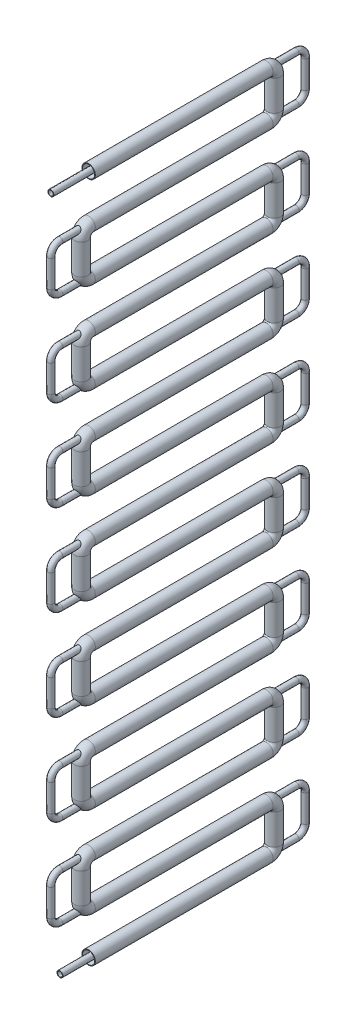
from build123d import *

# Parameters (mm, degrees)
SECCION_AGUA_R           = 8.8
SECCION_AGUA_R_2         = 8
SECCION_REFRIGERANTE_R   = 3.975
SECCION_REFRIGERANTE_R_2 = 3.175


with BuildPart() as part:
    # Tuberia agua: sweep along a path in Recorrido agua
    with BuildLine(Plane(origin=(0, 0, 0), x_dir=(0, 0, -1), z_dir=(1, 0, 0))) as tuberia_agua_path:
        Line((0, 0), (235, 0))
        ThreePointArc((235, 0), (242.071067812, -2.928932188), (245, -10))
        Line((245, -10), (245, -50))
        ThreePointArc((245, -50), (242.071067812, -57.071067812), (235, -60))
        Line((235, -60), (0, -60))
        ThreePointArc((0, -60), (-7.071067812, -62.928932188), (-10, -70))
        Line((-10, -70), (-10, -110))
        ThreePointArc((-10, -110), (-7.071067812, -117.071067812), (0, -120))
        Line((0, -120), (235, -120))
        ThreePointArc((235, -120), (242.071067812, -122.928932188), (245, -130))
        Line((245, -130), (245, -170))
        ThreePointArc((245, -170), (242.071067812, -177.071067812), (235, -180))
        Line((235, -180), (0, -180))
        ThreePointArc((0, -180), (-7.071067812, -182.928932188), (-10, -190))
        Line((-10, -190), (-10, -230))
        ThreePointArc((-10, -230), (-7.071067812, -237.071067812), (0, -240))
        Line((0, -240), (235, -240))
        ThreePointArc((235, -240), (242.071067812, -242.928932188), (245, -250))
        Line((245, -250), (245, -290))
        ThreePointArc((245, -290), (242.071067812, -297.071067812), (235, -300))
        Line((235, -300), (0, -300))
        ThreePointArc((0, -300), (-7.071067812, -302.928932188), (-10, -310))
        Line((-10, -310), (-10, -350))
        ThreePointArc((-10, -350), (-7.071067812, -357.071067812), (0, -360))
        Line((0, -360), (235, -360))
        ThreePointArc((235, -360), (242.071067812, -362.928932188), (245, -370))
        Line((245, -370), (245, -410))
        ThreePointArc((245, -410), (242.071067812, -417.071067812), (235, -420))
        Line((235, -420), (0, -420))
        ThreePointArc((0, -420), (-7.071067812, -422.928932188), (-10, -430))
        Line((-10, -430), (-10, -470))
        ThreePointArc((-10, -470), (-7.071067812, -477.071067812), (0, -480))
        Line((0, -480), (235, -480))
        ThreePointArc((235, -480), (242.071067812, -482.928932188), (245, -490))
        Line((245, -490), (245, -530))
        ThreePointArc((245, -530), (242.071067812, -537.071067812), (235, -540))
        Line((235, -540), (0, -540))
        ThreePointArc((0, -540), (-7.071067812, -542.928932188), (-10, -550))
        Line((-10, -550), (-10, -590))
        ThreePointArc((-10, -590), (-7.071067812, -597.071067812), (0, -600))
        Line((0, -600), (235, -600))
        ThreePointArc((235, -600), (242.071067812, -602.928932188), (245, -610))
        Line((245, -610), (245, -650))
        ThreePointArc((245, -650), (242.071067812, -657.071067812), (235, -660))
        Line((235, -660), (0, -660))
        ThreePointArc((0, -660), (-7.071067812, -662.928932188), (-10, -670))
        Line((-10, -670), (-10, -710))
        ThreePointArc((-10, -710), (-7.071067812, -717.071067812), (0, -720))
        Line((0, -720), (235, -720))
        ThreePointArc((235, -720), (242.071067812, -722.928932188), (245, -730))
        Line((245, -730), (245, -770))
        ThreePointArc((245, -770), (242.071067812, -777.071067812), (235, -780))
        Line((235, -780), (0, -780))
        ThreePointArc((0, -780), (-7.071067812, -782.928932188), (-10, -790))
        Line((-10, -790), (-10, -830))
        ThreePointArc((-10, -830), (-7.071067812, -837.071067812), (0, -840))
        Line((0, -840), (235, -840))
        ThreePointArc((235, -840), (242.071067812, -842.928932188), (245, -850))
        Line((245, -850), (245, -890))
        ThreePointArc((245, -890), (242.071067812, -897.071067812), (235, -900))
        Line((235, -900), (0, -900))
    # Seccion agua → Tuberia agua (sweep)
    with BuildSketch(Plane.XY):
        Circle(SECCION_AGUA_R)
        Circle(SECCION_AGUA_R_2, mode=Mode.SUBTRACT)
    sweep(path=tuberia_agua_path.line)

    # Tuberia refrigerante: sweep along a path in Recorrido refrigerante
    with BuildLine(Plane(origin=(0, 0, 0), x_dir=(0, 0, -1), z_dir=(1, 0, 0))) as tuberia_refrigerante_path:
        Line((-50, 0), (274.2, 0))
        ThreePointArc((274.2, 0), (282.685281374, -3.514718626), (286.2, -12))
        Line((286.2, -12), (286.2, -48))
        ThreePointArc((286.2, -48), (282.685281374, -56.485281374), (274.2, -60))
        Line((274.2, -60), (-38, -60))
        ThreePointArc((-38, -60), (-46.485281374, -63.514718626), (-50, -72))
        Line((-50, -72), (-50, -108))
        ThreePointArc((-50, -108), (-46.485281374, -116.485281374), (-38, -120))
        Line((-38, -120), (274.2, -120))
        ThreePointArc((274.2, -120), (282.685281374, -123.514718626), (286.2, -132))
        Line((286.2, -132), (286.2, -168))
        ThreePointArc((286.2, -168), (282.685281374, -176.485281374), (274.2, -180))
        Line((274.2, -180), (-38, -180))
        ThreePointArc((-38, -180), (-46.485281374, -183.514718626), (-50, -192))
        Line((-50, -192), (-50, -228))
        ThreePointArc((-50, -228), (-46.485281374, -236.485281374), (-38, -240))
        Line((-38, -240), (274.2, -240))
        ThreePointArc((274.2, -240), (282.685281374, -243.514718626), (286.2, -252))
        Line((286.2, -252), (286.2, -288))
        ThreePointArc((286.2, -288), (282.685281374, -296.485281374), (274.2, -300))
        Line((274.2, -300), (-38, -300))
        ThreePointArc((-38, -300), (-46.485281374, -303.514718626), (-50, -312))
        Line((-50, -312), (-50, -348))
        ThreePointArc((-50, -348), (-46.485281374, -356.485281374), (-38, -360))
        Line((-38, -360), (274.2, -360))
        ThreePointArc((274.2, -360), (282.685281374, -363.514718626), (286.2, -372))
        Line((286.2, -372), (286.2, -408))
        ThreePointArc((286.2, -408), (282.685281374, -416.485281374), (274.2, -420))
        Line((274.2, -420), (-38, -420))
        ThreePointArc((-38, -420), (-46.485281374, -423.514718626), (-50, -432))
        Line((-50, -432), (-50, -468))
        ThreePointArc((-50, -468), (-46.485281374, -476.485281374), (-38, -480))
        Line((-38, -480), (274.2, -480))
        ThreePointArc((274.2, -480), (282.685281374, -483.514718626), (286.2, -492))
        Line((286.2, -492), (286.2, -528))
        ThreePointArc((286.2, -528), (282.685281374, -536.485281374), (274.2, -540))
        Line((274.2, -540), (-38, -540))
        ThreePointArc((-38, -540), (-46.485281374, -543.514718626), (-50, -552))
        Line((-50, -552), (-50, -588))
        ThreePointArc((-50, -588), (-46.485281374, -596.485281374), (-38, -600))
        Line((-38, -600), (274.2, -600))
        ThreePointArc((274.2, -600), (282.685281374, -603.514718626), (286.2, -612))
        Line((286.2, -612), (286.2, -648))
        ThreePointArc((286.2, -648), (282.685281374, -656.485281374), (274.2, -660))
        Line((274.2, -660), (-38, -660))
        ThreePointArc((-38, -660), (-46.485281374, -663.514718626), (-50, -672))
        Line((-50, -672), (-50, -708))
        ThreePointArc((-50, -708), (-46.485281374, -716.485281374), (-38, -720))
        Line((-38, -720), (274.2, -720))
        ThreePointArc((274.2, -720), (282.685281374, -723.514718626), (286.2, -732))
        Line((286.2, -732), (286.2, -768))
        ThreePointArc((286.2, -768), (282.685281374, -776.485281374), (274.2, -780))
        Line((274.2, -780), (-38, -780))
        ThreePointArc((-38, -780), (-46.485281374, -783.514718626), (-50, -792))
        Line((-50, -792), (-50, -828))
        ThreePointArc((-50, -828), (-46.485281374, -836.485281374), (-38, -840))
        Line((-38, -840), (274.2, -840))
        ThreePointArc((274.2, -840), (282.685281374, -843.514718626), (286.2, -852))
        Line((286.2, -852), (286.2, -888))
        ThreePointArc((286.2, -888), (282.685281374, -896.485281374), (274.2, -900))
        Line((274.2, -900), (-38, -900))
    # Seccion refrigerante → Tuberia refrigerante (sweep)
    with BuildSketch(Plane.XY.offset(50)):
        Circle(SECCION_REFRIGERANTE_R)
        Circle(SECCION_REFRIGERANTE_R_2, mode=Mode.SUBTRACT)
    sweep(path=tuberia_refrigerante_path.line)


solid = part.part
